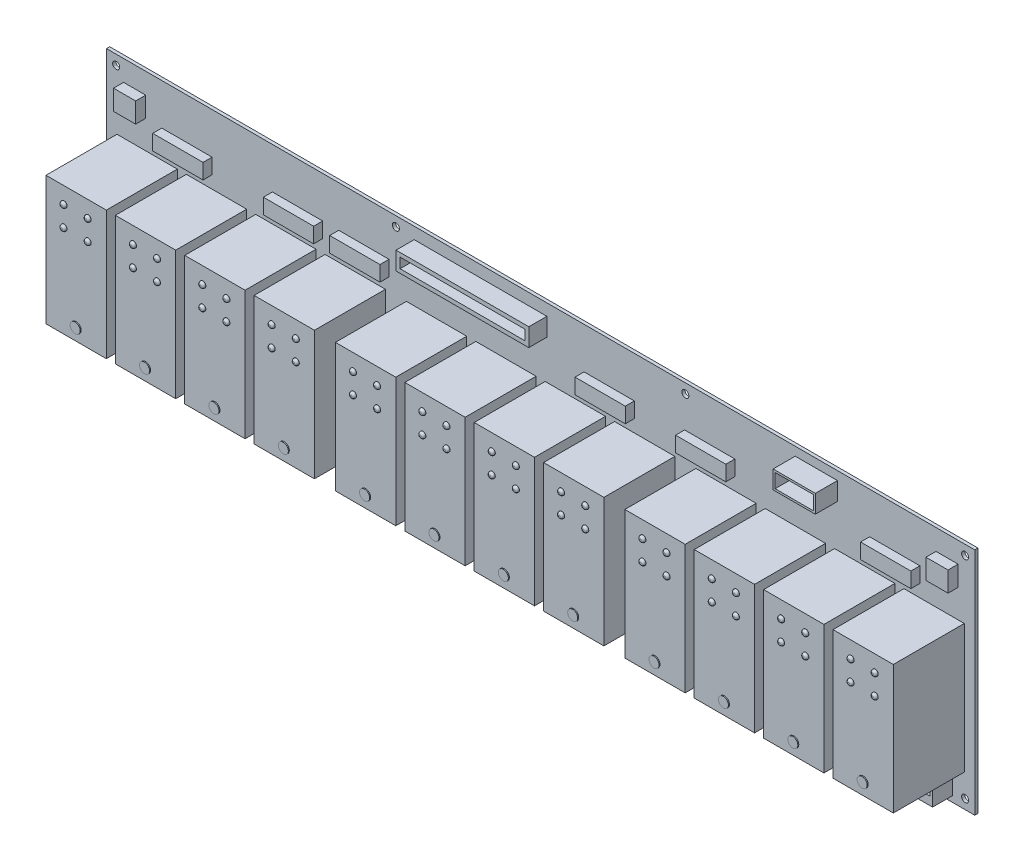
from build123d import *

# Parameters (mm, degrees)
SKETCH1_W        = 431.8
SKETCH1_H        = 114.3
PCB_DEPTH        = 1.6
SKETCH2_W        = 25
SKETCH2_H        = 7.6
BODY00_DEPTH     = 4.5
SKETCH3_W        = 11
SKETCH3_H        = 10
BODY01_DEPTH     = 5
SKETCH4_W        = 66
SKETCH4_H        = 9
BODY02_DEPTH     = 9
SKETCH5_W        = 121.92
SKETCH5_H        = 9
BODY03_DEPTH     = 10
SKETCH6_W        = 21
SKETCH6_H        = 9
BODY04_DEPTH     = 11
SKETCH7_W        = 30
SKETCH7_H        = 64
BODY05_DEPTH     = 35.3
SKETCH8_R        = 2.5
BODY06_DEPTH     = 0.5
SKETCH9_R        = 1.5
BODY07_DEPTH     = 1.2
SKETCH10_W       = 3.2
SKETCH10_H       = 3.2
CUT00_DEPTH      = 4
SKETCH11_W       = 62
SKETCH11_H       = 5
CUT01_DEPTH      = 7
SKETCH12_W       = 2.8
SKETCH12_H       = 2.8
CUT02_DEPTH      = 3
SKETCH13_W       = 19
SKETCH13_H       = 7
CUT03_DEPTH      = 8
SKETCH14_R       = 1.75
HOLES_DEPTH      = 1.6
ROUNDTOP0_R      = 1.1
ROUNDTOP0_FIX0_R = 1.1
ROUNDTOP0_FIX1_R = 1.1


with BuildPart() as part:
    # Sketch1 → PCB (new body)
    with BuildSketch(Plane.XY):
        with Locations((215.9, 57.15)):
            Rectangle(SKETCH1_W, SKETCH1_H)
    extrude(amount=PCB_DEPTH)

    # Sketch2 → Body00 (add)
    with BuildSketch(Plane.XY.offset(1.6)):
        with Locations((40, 90)):
            Rectangle(SKETCH2_W, SKETCH2_H)
        with Locations((95, 90)):
            Rectangle(SKETCH2_W, SKETCH2_H)
        with Locations((128, 90)):
            Rectangle(SKETCH2_W, SKETCH2_H)
        with Locations((250, 90)):
            Rectangle(SKETCH2_W, SKETCH2_H)
        with Locations((300, 90)):
            Rectangle(SKETCH2_W, SKETCH2_H)
        with Locations((392, 90)):
            Rectangle(SKETCH2_W, SKETCH2_H)
    extrude(amount=BODY00_DEPTH)

    # Sketch3 → Body01 (add)
    with BuildSketch(Plane.XY.offset(1.6)):
        with Locations((14, 99)):
            Rectangle(SKETCH3_W, SKETCH3_H)
        with Locations((418, 99)):
            Rectangle(SKETCH3_W, SKETCH3_H)
    extrude(amount=BODY01_DEPTH)

    # Sketch4 → Body02 (add)
    with BuildSketch(Plane.XY.offset(1.6)):
        with Locations((186, 104)):
            Rectangle(SKETCH4_W, SKETCH4_H)
    extrude(amount=BODY02_DEPTH)

    # Sketch5 → Body03 (add)
    with BuildSketch(Plane.XY.offset(1.6)):
        with Locations((71.967, 7.5)):
            Rectangle(SKETCH5_W, SKETCH5_H)
        with Locations((215.9, 7.5)):
            Rectangle(SKETCH5_W, SKETCH5_H)
        with Locations((359.833, 7.5)):
            Rectangle(SKETCH5_W, SKETCH5_H)
    extrude(amount=BODY03_DEPTH)

    # Sketch6 → Body04 (add)
    with BuildSketch(Plane.XY.offset(1.6)):
        with Locations((353, 105.5)):
            Rectangle(SKETCH6_W, SKETCH6_H)
    extrude(amount=BODY04_DEPTH)

    # Sketch7 → Body05 (add)
    with BuildSketch(Plane.XY.offset(1.6)):
        with Locations((20.217, 48)):
            Rectangle(SKETCH7_W, SKETCH7_H)
        with Locations((54.717, 48)):
            Rectangle(SKETCH7_W, SKETCH7_H)
        with Locations((89.217, 48)):
            Rectangle(SKETCH7_W, SKETCH7_H)
        with Locations((123.717, 48)):
            Rectangle(SKETCH7_W, SKETCH7_H)
        with Locations((164.15, 48)):
            Rectangle(SKETCH7_W, SKETCH7_H)
        with Locations((198.65, 48)):
            Rectangle(SKETCH7_W, SKETCH7_H)
        with Locations((233.15, 48)):
            Rectangle(SKETCH7_W, SKETCH7_H)
        with Locations((267.65, 48)):
            Rectangle(SKETCH7_W, SKETCH7_H)
        with Locations((308.083, 48)):
            Rectangle(SKETCH7_W, SKETCH7_H)
        with Locations((342.583, 48)):
            Rectangle(SKETCH7_W, SKETCH7_H)
        with Locations((377.083, 48)):
            Rectangle(SKETCH7_W, SKETCH7_H)
        with Locations((411.583, 48)):
            Rectangle(SKETCH7_W, SKETCH7_H)
    extrude(amount=BODY05_DEPTH)

    # Sketch8 → Body06 (add)
    with BuildSketch(Plane.XY.offset(36.9)):
        with Locations((20.217, 22)):
            Circle(SKETCH8_R)
        with Locations((54.717, 22)):
            Circle(SKETCH8_R)
        with Locations((89.217, 22)):
            Circle(SKETCH8_R)
        with Locations((123.717, 22)):
            Circle(SKETCH8_R)
        with Locations((164.15, 22)):
            Circle(SKETCH8_R)
        with Locations((198.65, 22)):
            Circle(SKETCH8_R)
        with Locations((233.15, 22)):
            Circle(SKETCH8_R)
        with Locations((267.65, 22)):
            Circle(SKETCH8_R)
        with Locations((308.083, 22)):
            Circle(SKETCH8_R)
        with Locations((342.583, 22)):
            Circle(SKETCH8_R)
        with Locations((377.083, 22)):
            Circle(SKETCH8_R)
        with Locations((411.583, 22)):
            Circle(SKETCH8_R)
    extrude(amount=BODY06_DEPTH)

    # Sketch9 → Body07 (add)
    with BuildSketch(Plane.XY.offset(36.9)):
        with Locations((14.217, 62)):
            Circle(SKETCH9_R)
        with Locations((14.217, 72)):
            Circle(SKETCH9_R)
        with Locations((26.217, 62)):
            Circle(SKETCH9_R)
        with Locations((26.217, 72)):
            Circle(SKETCH9_R)
        with Locations((48.717, 62)):
            Circle(SKETCH9_R)
        with Locations((48.717, 72)):
            Circle(SKETCH9_R)
        with Locations((60.717, 62)):
            Circle(SKETCH9_R)
        with Locations((60.717, 72)):
            Circle(SKETCH9_R)
        with Locations((83.217, 62)):
            Circle(SKETCH9_R)
        with Locations((83.217, 72)):
            Circle(SKETCH9_R)
        with Locations((95.217, 62)):
            Circle(SKETCH9_R)
        with Locations((95.217, 72)):
            Circle(SKETCH9_R)
        with Locations((117.717, 62)):
            Circle(SKETCH9_R)
        with Locations((117.717, 72)):
            Circle(SKETCH9_R)
        with Locations((129.717, 62)):
            Circle(SKETCH9_R)
        with Locations((129.717, 72)):
            Circle(SKETCH9_R)
        with Locations((158.15, 62)):
            Circle(SKETCH9_R)
        with Locations((158.15, 72)):
            Circle(SKETCH9_R)
        with Locations((170.15, 62)):
            Circle(SKETCH9_R)
        with Locations((170.15, 72)):
            Circle(SKETCH9_R)
        with Locations((192.65, 62)):
            Circle(SKETCH9_R)
        with Locations((192.65, 72)):
            Circle(SKETCH9_R)
        with Locations((204.65, 62)):
            Circle(SKETCH9_R)
        with Locations((204.65, 72)):
            Circle(SKETCH9_R)
        with Locations((227.15, 62)):
            Circle(SKETCH9_R)
        with Locations((227.15, 72)):
            Circle(SKETCH9_R)
        with Locations((239.15, 62)):
            Circle(SKETCH9_R)
        with Locations((239.15, 72)):
            Circle(SKETCH9_R)
        with Locations((261.65, 62)):
            Circle(SKETCH9_R)
        with Locations((261.65, 72)):
            Circle(SKETCH9_R)
        with Locations((273.65, 62)):
            Circle(SKETCH9_R)
        with Locations((273.65, 72)):
            Circle(SKETCH9_R)
        with Locations((302.083, 62)):
            Circle(SKETCH9_R)
        with Locations((302.083, 72)):
            Circle(SKETCH9_R)
        with Locations((314.083, 62)):
            Circle(SKETCH9_R)
        with Locations((314.083, 72)):
            Circle(SKETCH9_R)
        with Locations((336.583, 62)):
            Circle(SKETCH9_R)
        with Locations((336.583, 72)):
            Circle(SKETCH9_R)
        with Locations((348.583, 62)):
            Circle(SKETCH9_R)
        with Locations((348.583, 72)):
            Circle(SKETCH9_R)
        with Locations((371.083, 62)):
            Circle(SKETCH9_R)
        with Locations((371.083, 72)):
            Circle(SKETCH9_R)
        with Locations((383.083, 62)):
            Circle(SKETCH9_R)
        with Locations((383.083, 72)):
            Circle(SKETCH9_R)
        with Locations((405.583, 62)):
            Circle(SKETCH9_R)
        with Locations((405.583, 72)):
            Circle(SKETCH9_R)
        with Locations((417.583, 62)):
            Circle(SKETCH9_R)
        with Locations((417.583, 72)):
            Circle(SKETCH9_R)
    extrude(amount=BODY07_DEPTH)

    # Sketch10 → Cut00 (cut)
    with BuildSketch(Plane(origin=(0, 7, 0), x_dir=(1, 0, 0), z_dir=(0, 1, 0))):
        with Locations((13.547, -5.1)):
            Rectangle(SKETCH10_W, SKETCH10_H)
        with Locations((18.627, -5.1)):
            Rectangle(SKETCH10_W, SKETCH10_H)
        with Locations((23.707, -5.1)):
            Rectangle(SKETCH10_W, SKETCH10_H)
        with Locations((28.787, -5.1)):
            Rectangle(SKETCH10_W, SKETCH10_H)
        with Locations((33.867, -5.1)):
            Rectangle(SKETCH10_W, SKETCH10_H)
        with Locations((38.947, -5.1)):
            Rectangle(SKETCH10_W, SKETCH10_H)
        with Locations((44.027, -5.1)):
            Rectangle(SKETCH10_W, SKETCH10_H)
        with Locations((49.107, -5.1)):
            Rectangle(SKETCH10_W, SKETCH10_H)
        with Locations((54.187, -5.1)):
            Rectangle(SKETCH10_W, SKETCH10_H)
        with Locations((59.267, -5.1)):
            Rectangle(SKETCH10_W, SKETCH10_H)
        with Locations((64.347, -5.1)):
            Rectangle(SKETCH10_W, SKETCH10_H)
        with Locations((69.427, -5.1)):
            Rectangle(SKETCH10_W, SKETCH10_H)
        with Locations((74.507, -5.1)):
            Rectangle(SKETCH10_W, SKETCH10_H)
        with Locations((79.587, -5.1)):
            Rectangle(SKETCH10_W, SKETCH10_H)
        with Locations((84.667, -5.1)):
            Rectangle(SKETCH10_W, SKETCH10_H)
        with Locations((89.747, -5.1)):
            Rectangle(SKETCH10_W, SKETCH10_H)
        with Locations((94.827, -5.1)):
            Rectangle(SKETCH10_W, SKETCH10_H)
        with Locations((99.907, -5.1)):
            Rectangle(SKETCH10_W, SKETCH10_H)
        with Locations((104.987, -5.1)):
            Rectangle(SKETCH10_W, SKETCH10_H)
        with Locations((110.067, -5.1)):
            Rectangle(SKETCH10_W, SKETCH10_H)
        with Locations((115.147, -5.1)):
            Rectangle(SKETCH10_W, SKETCH10_H)
        with Locations((120.227, -5.1)):
            Rectangle(SKETCH10_W, SKETCH10_H)
        with Locations((125.307, -5.1)):
            Rectangle(SKETCH10_W, SKETCH10_H)
        with Locations((130.387, -5.1)):
            Rectangle(SKETCH10_W, SKETCH10_H)
        with Locations((157.48, -5.1)):
            Rectangle(SKETCH10_W, SKETCH10_H)
        with Locations((162.56, -5.1)):
            Rectangle(SKETCH10_W, SKETCH10_H)
        with Locations((167.64, -5.1)):
            Rectangle(SKETCH10_W, SKETCH10_H)
        with Locations((172.72, -5.1)):
            Rectangle(SKETCH10_W, SKETCH10_H)
        with Locations((177.8, -5.1)):
            Rectangle(SKETCH10_W, SKETCH10_H)
        with Locations((182.88, -5.1)):
            Rectangle(SKETCH10_W, SKETCH10_H)
        with Locations((187.96, -5.1)):
            Rectangle(SKETCH10_W, SKETCH10_H)
        with Locations((193.04, -5.1)):
            Rectangle(SKETCH10_W, SKETCH10_H)
        with Locations((198.12, -5.1)):
            Rectangle(SKETCH10_W, SKETCH10_H)
        with Locations((203.2, -5.1)):
            Rectangle(SKETCH10_W, SKETCH10_H)
        with Locations((208.28, -5.1)):
            Rectangle(SKETCH10_W, SKETCH10_H)
        with Locations((213.36, -5.1)):
            Rectangle(SKETCH10_W, SKETCH10_H)
        with Locations((218.44, -5.1)):
            Rectangle(SKETCH10_W, SKETCH10_H)
        with Locations((223.52, -5.1)):
            Rectangle(SKETCH10_W, SKETCH10_H)
        with Locations((228.6, -5.1)):
            Rectangle(SKETCH10_W, SKETCH10_H)
        with Locations((233.68, -5.1)):
            Rectangle(SKETCH10_W, SKETCH10_H)
        with Locations((238.76, -5.1)):
            Rectangle(SKETCH10_W, SKETCH10_H)
        with Locations((243.84, -5.1)):
            Rectangle(SKETCH10_W, SKETCH10_H)
        with Locations((248.92, -5.1)):
            Rectangle(SKETCH10_W, SKETCH10_H)
        with Locations((254, -5.1)):
            Rectangle(SKETCH10_W, SKETCH10_H)
        with Locations((259.08, -5.1)):
            Rectangle(SKETCH10_W, SKETCH10_H)
        with Locations((264.16, -5.1)):
            Rectangle(SKETCH10_W, SKETCH10_H)
        with Locations((269.24, -5.1)):
            Rectangle(SKETCH10_W, SKETCH10_H)
        with Locations((274.32, -5.1)):
            Rectangle(SKETCH10_W, SKETCH10_H)
        with Locations((301.413, -5.1)):
            Rectangle(SKETCH10_W, SKETCH10_H)
        with Locations((306.493, -5.1)):
            Rectangle(SKETCH10_W, SKETCH10_H)
        with Locations((311.573, -5.1)):
            Rectangle(SKETCH10_W, SKETCH10_H)
        with Locations((316.653, -5.1)):
            Rectangle(SKETCH10_W, SKETCH10_H)
        with Locations((321.733, -5.1)):
            Rectangle(SKETCH10_W, SKETCH10_H)
        with Locations((326.813, -5.1)):
            Rectangle(SKETCH10_W, SKETCH10_H)
        with Locations((331.893, -5.1)):
            Rectangle(SKETCH10_W, SKETCH10_H)
        with Locations((336.973, -5.1)):
            Rectangle(SKETCH10_W, SKETCH10_H)
        with Locations((342.053, -5.1)):
            Rectangle(SKETCH10_W, SKETCH10_H)
        with Locations((347.133, -5.1)):
            Rectangle(SKETCH10_W, SKETCH10_H)
        with Locations((352.213, -5.1)):
            Rectangle(SKETCH10_W, SKETCH10_H)
        with Locations((357.293, -5.1)):
            Rectangle(SKETCH10_W, SKETCH10_H)
        with Locations((362.373, -5.1)):
            Rectangle(SKETCH10_W, SKETCH10_H)
        with Locations((367.453, -5.1)):
            Rectangle(SKETCH10_W, SKETCH10_H)
        with Locations((372.533, -5.1)):
            Rectangle(SKETCH10_W, SKETCH10_H)
        with Locations((377.613, -5.1)):
            Rectangle(SKETCH10_W, SKETCH10_H)
        with Locations((382.693, -5.1)):
            Rectangle(SKETCH10_W, SKETCH10_H)
        with Locations((387.773, -5.1)):
            Rectangle(SKETCH10_W, SKETCH10_H)
        with Locations((392.853, -5.1)):
            Rectangle(SKETCH10_W, SKETCH10_H)
        with Locations((397.933, -5.1)):
            Rectangle(SKETCH10_W, SKETCH10_H)
        with Locations((403.013, -5.1)):
            Rectangle(SKETCH10_W, SKETCH10_H)
        with Locations((408.093, -5.1)):
            Rectangle(SKETCH10_W, SKETCH10_H)
        with Locations((413.173, -5.1)):
            Rectangle(SKETCH10_W, SKETCH10_H)
        with Locations((418.253, -5.1)):
            Rectangle(SKETCH10_W, SKETCH10_H)
    extrude(amount=-CUT00_DEPTH, mode=Mode.SUBTRACT)

    # Sketch11 → Cut01 (cut)
    with BuildSketch(Plane.XY.offset(10.6)):
        with Locations((186, 104)):
            Rectangle(SKETCH11_W, SKETCH11_H)
    extrude(amount=-CUT01_DEPTH, mode=Mode.SUBTRACT)

    # Sketch12 → Cut02 (cut)
    with BuildSketch(Plane.XY.offset(11.6)):
        with Locations((13.547, 8.5)):
            Rectangle(SKETCH12_W, SKETCH12_H)
        with Locations((18.627, 8.5)):
            Rectangle(SKETCH12_W, SKETCH12_H)
        with Locations((23.707, 8.5)):
            Rectangle(SKETCH12_W, SKETCH12_H)
        with Locations((28.787, 8.5)):
            Rectangle(SKETCH12_W, SKETCH12_H)
        with Locations((33.867, 8.5)):
            Rectangle(SKETCH12_W, SKETCH12_H)
        with Locations((38.947, 8.5)):
            Rectangle(SKETCH12_W, SKETCH12_H)
        with Locations((44.027, 8.5)):
            Rectangle(SKETCH12_W, SKETCH12_H)
        with Locations((49.107, 8.5)):
            Rectangle(SKETCH12_W, SKETCH12_H)
        with Locations((54.187, 8.5)):
            Rectangle(SKETCH12_W, SKETCH12_H)
        with Locations((59.267, 8.5)):
            Rectangle(SKETCH12_W, SKETCH12_H)
        with Locations((64.347, 8.5)):
            Rectangle(SKETCH12_W, SKETCH12_H)
        with Locations((69.427, 8.5)):
            Rectangle(SKETCH12_W, SKETCH12_H)
        with Locations((74.507, 8.5)):
            Rectangle(SKETCH12_W, SKETCH12_H)
        with Locations((79.587, 8.5)):
            Rectangle(SKETCH12_W, SKETCH12_H)
        with Locations((84.667, 8.5)):
            Rectangle(SKETCH12_W, SKETCH12_H)
        with Locations((89.747, 8.5)):
            Rectangle(SKETCH12_W, SKETCH12_H)
        with Locations((94.827, 8.5)):
            Rectangle(SKETCH12_W, SKETCH12_H)
        with Locations((99.907, 8.5)):
            Rectangle(SKETCH12_W, SKETCH12_H)
        with Locations((104.987, 8.5)):
            Rectangle(SKETCH12_W, SKETCH12_H)
        with Locations((110.067, 8.5)):
            Rectangle(SKETCH12_W, SKETCH12_H)
        with Locations((115.147, 8.5)):
            Rectangle(SKETCH12_W, SKETCH12_H)
        with Locations((120.227, 8.5)):
            Rectangle(SKETCH12_W, SKETCH12_H)
        with Locations((125.307, 8.5)):
            Rectangle(SKETCH12_W, SKETCH12_H)
        with Locations((130.387, 8.5)):
            Rectangle(SKETCH12_W, SKETCH12_H)
        with Locations((157.48, 8.5)):
            Rectangle(SKETCH12_W, SKETCH12_H)
        with Locations((162.56, 8.5)):
            Rectangle(SKETCH12_W, SKETCH12_H)
        with Locations((167.64, 8.5)):
            Rectangle(SKETCH12_W, SKETCH12_H)
        with Locations((172.72, 8.5)):
            Rectangle(SKETCH12_W, SKETCH12_H)
        with Locations((177.8, 8.5)):
            Rectangle(SKETCH12_W, SKETCH12_H)
        with Locations((182.88, 8.5)):
            Rectangle(SKETCH12_W, SKETCH12_H)
        with Locations((187.96, 8.5)):
            Rectangle(SKETCH12_W, SKETCH12_H)
        with Locations((193.04, 8.5)):
            Rectangle(SKETCH12_W, SKETCH12_H)
        with Locations((198.12, 8.5)):
            Rectangle(SKETCH12_W, SKETCH12_H)
        with Locations((203.2, 8.5)):
            Rectangle(SKETCH12_W, SKETCH12_H)
        with Locations((208.28, 8.5)):
            Rectangle(SKETCH12_W, SKETCH12_H)
        with Locations((213.36, 8.5)):
            Rectangle(SKETCH12_W, SKETCH12_H)
        with Locations((218.44, 8.5)):
            Rectangle(SKETCH12_W, SKETCH12_H)
        with Locations((223.52, 8.5)):
            Rectangle(SKETCH12_W, SKETCH12_H)
        with Locations((228.6, 8.5)):
            Rectangle(SKETCH12_W, SKETCH12_H)
        with Locations((233.68, 8.5)):
            Rectangle(SKETCH12_W, SKETCH12_H)
        with Locations((238.76, 8.5)):
            Rectangle(SKETCH12_W, SKETCH12_H)
        with Locations((243.84, 8.5)):
            Rectangle(SKETCH12_W, SKETCH12_H)
        with Locations((248.92, 8.5)):
            Rectangle(SKETCH12_W, SKETCH12_H)
        with Locations((254, 8.5)):
            Rectangle(SKETCH12_W, SKETCH12_H)
        with Locations((259.08, 8.5)):
            Rectangle(SKETCH12_W, SKETCH12_H)
        with Locations((264.16, 8.5)):
            Rectangle(SKETCH12_W, SKETCH12_H)
        with Locations((269.24, 8.5)):
            Rectangle(SKETCH12_W, SKETCH12_H)
        with Locations((274.32, 8.5)):
            Rectangle(SKETCH12_W, SKETCH12_H)
        with Locations((301.413, 8.5)):
            Rectangle(SKETCH12_W, SKETCH12_H)
        with Locations((306.493, 8.5)):
            Rectangle(SKETCH12_W, SKETCH12_H)
        with Locations((311.573, 8.5)):
            Rectangle(SKETCH12_W, SKETCH12_H)
        with Locations((316.653, 8.5)):
            Rectangle(SKETCH12_W, SKETCH12_H)
        with Locations((321.733, 8.5)):
            Rectangle(SKETCH12_W, SKETCH12_H)
        with Locations((326.813, 8.5)):
            Rectangle(SKETCH12_W, SKETCH12_H)
        with Locations((331.893, 8.5)):
            Rectangle(SKETCH12_W, SKETCH12_H)
        with Locations((336.973, 8.5)):
            Rectangle(SKETCH12_W, SKETCH12_H)
        with Locations((342.053, 8.5)):
            Rectangle(SKETCH12_W, SKETCH12_H)
        with Locations((347.133, 8.5)):
            Rectangle(SKETCH12_W, SKETCH12_H)
        with Locations((352.213, 8.5)):
            Rectangle(SKETCH12_W, SKETCH12_H)
        with Locations((357.293, 8.5)):
            Rectangle(SKETCH12_W, SKETCH12_H)
        with Locations((362.373, 8.5)):
            Rectangle(SKETCH12_W, SKETCH12_H)
        with Locations((367.453, 8.5)):
            Rectangle(SKETCH12_W, SKETCH12_H)
        with Locations((372.533, 8.5)):
            Rectangle(SKETCH12_W, SKETCH12_H)
        with Locations((377.613, 8.5)):
            Rectangle(SKETCH12_W, SKETCH12_H)
        with Locations((382.693, 8.5)):
            Rectangle(SKETCH12_W, SKETCH12_H)
        with Locations((387.773, 8.5)):
            Rectangle(SKETCH12_W, SKETCH12_H)
        with Locations((392.853, 8.5)):
            Rectangle(SKETCH12_W, SKETCH12_H)
        with Locations((397.933, 8.5)):
            Rectangle(SKETCH12_W, SKETCH12_H)
        with Locations((403.013, 8.5)):
            Rectangle(SKETCH12_W, SKETCH12_H)
        with Locations((408.093, 8.5)):
            Rectangle(SKETCH12_W, SKETCH12_H)
        with Locations((413.173, 8.5)):
            Rectangle(SKETCH12_W, SKETCH12_H)
        with Locations((418.253, 8.5)):
            Rectangle(SKETCH12_W, SKETCH12_H)
    extrude(amount=-CUT02_DEPTH, mode=Mode.SUBTRACT)

    # Sketch13 → Cut03 (cut)
    with BuildSketch(Plane.XY.offset(12.6)):
        with Locations((353, 105.5)):
            Rectangle(SKETCH13_W, SKETCH13_H)
    extrude(amount=-CUT03_DEPTH, mode=Mode.SUBTRACT)

    # Sketch14 → Holes (cut)
    with BuildSketch(Plane.XY.offset(1.6)):
        with Locations((4.8, 4.8)):
            Circle(SKETCH14_R)
        with Locations((4.8, 109.5)):
            Circle(SKETCH14_R)
        with Locations((143.933, 4.8)):
            Circle(SKETCH14_R)
        with Locations((143.933, 109.5)):
            Circle(SKETCH14_R)
        with Locations((287.867, 4.8)):
            Circle(SKETCH14_R)
        with Locations((287.867, 109.5)):
            Circle(SKETCH14_R)
        with Locations((427, 4.8)):
            Circle(SKETCH14_R)
        with Locations((427, 109.5)):
            Circle(SKETCH14_R)
    extrude(amount=-HOLES_DEPTH, mode=Mode.SUBTRACT)

    # RoundTop0
    roundtop0_edges = [part.edges().sort_by_distance(p)[0] for p in [
        (416.083, 72, 38.1),
        (416.083, 62, 38.1),
        (404.083, 72, 38.1),
        (404.083, 62, 38.1),
        (381.583, 72, 38.1),
        (381.583, 62, 38.1),
        (369.583, 72, 38.1),
        (369.583, 62, 38.1),
        (347.083, 72, 38.1),
        (347.083, 62, 38.1),
        (335.083, 72, 38.1),
        (335.083, 62, 38.1),
        (312.583, 72, 38.1),
        (312.583, 62, 38.1),
        (300.583, 72, 38.1),
        (300.583, 62, 38.1),
        (272.15, 72, 38.1),
        (272.15, 62, 38.1),
        (260.15, 72, 38.1),
        (260.15, 62, 38.1),
        (237.65, 62, 38.1),
        (225.65, 62, 38.1),
        (203.15, 72, 38.1),
        (203.15, 62, 38.1),
        (191.15, 72, 38.1),
        (191.15, 62, 38.1),
        (168.65, 72, 38.1),
        (168.65, 62, 38.1),
        (156.65, 72, 38.1),
        (156.65, 62, 38.1),
        (128.217, 72, 38.1),
        (128.217, 62, 38.1),
        (116.217, 72, 38.1),
        (116.217, 62, 38.1),
        (93.717, 72, 38.1),
        (93.717, 62, 38.1),
        (81.717, 72, 38.1),
        (81.717, 62, 38.1),
        (59.217, 72, 38.1),
        (59.217, 62, 38.1),
        (47.217, 72, 38.1),
        (47.217, 62, 38.1),
        (24.717, 72, 38.1),
        (24.717, 62, 38.1),
        (12.717, 72, 38.1),
        (12.717, 62, 38.1),
    ]]
    fillet(roundtop0_edges, radius=ROUNDTOP0_R)

    # RoundTop0_fix0
    roundtop0_fix0_edges = [part.edges().sort_by_distance(p)[0] for p in [
        (225.65, 72, 38.1),
    ]]
    fillet(roundtop0_fix0_edges, radius=ROUNDTOP0_FIX0_R)

    # RoundTop0_fix1
    roundtop0_fix1_edges = [part.edges().sort_by_distance(p)[0] for p in [
        (237.65, 72, 38.1),
    ]]
    fillet(roundtop0_fix1_edges, radius=ROUNDTOP0_FIX1_R)


solid = part.part
